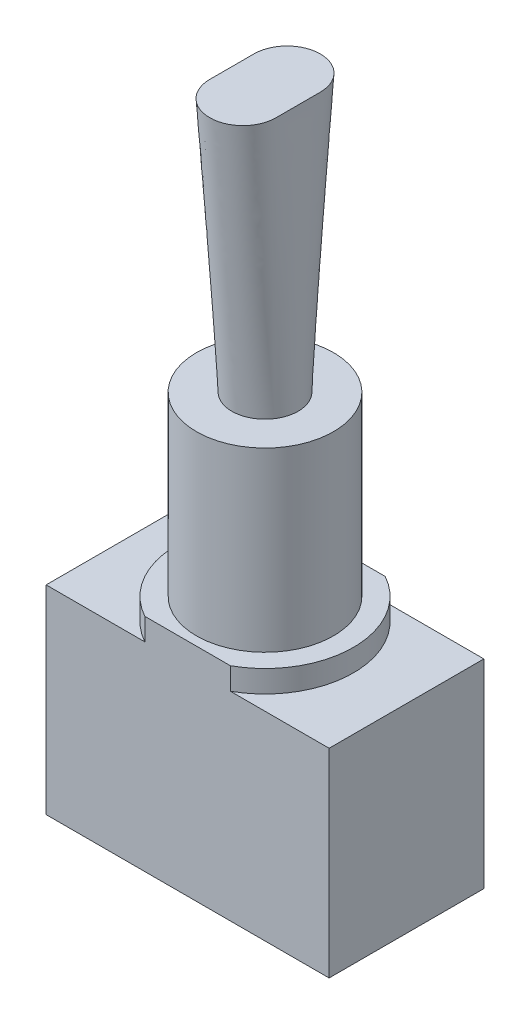
from build123d import *

# Parameters (mm, degrees)
ESQUISSE1_W        = 12.8
ESQUISSE1_H        = 9
BOSS_EXTRU_1_DEPTH = 3.5
BOSS_EXTRU_2_DEPTH = 1
ESQUISSE3_R        = 3.1
BOSS_EXTRU_3_DEPTH = 8


with BuildPart() as part:
    # Esquisse1 → Boss.-Extru.1 (new, symmetric)
    with BuildSketch(Plane.XY):
        with Locations((0, -4.5)):
            Rectangle(ESQUISSE1_W, ESQUISSE1_H)
    extrude(amount=BOSS_EXTRU_1_DEPTH, both=True)

    # Esquisse2 → Boss.-Extru.2 (add)
    with BuildSketch(Plane(origin=(0, 0, 0), x_dir=(1, 0, 0), z_dir=(0, 1, 0))):
        with BuildLine():
            Line((1.936491673, 3.5), (-1.936491673, 3.5))
            ThreePointArc((-1.936491673, 3.5), (-4, 0), (-1.936491673, -3.5))
            Line((-1.936491673, -3.5), (1.936491673, -3.5))
            ThreePointArc((1.936491673, -3.5), (4, 0), (1.936491673, 3.5))
        make_face()
    extrude(amount=BOSS_EXTRU_2_DEPTH)

    # Esquisse3 → Boss.-Extru.3 (add)
    with BuildSketch(Plane(origin=(0, 1, 0), x_dir=(1, 0, 0), z_dir=(0, 1, 0))):
        with Locations(Location((0, 0, 0), (0, 0, 180))):
            Circle(ESQUISSE3_R)
    extrude(amount=BOSS_EXTRU_3_DEPTH)

    # Lissage1: read off the stored shape, not the designer's step
    # Lissage1: loft between two sections, ruled curve by curve
    lissage1_from = [
        Edge.make_bspline([(-1.5, 21, -0.999999999), (-1.5, 21, -1.18566879), (-1.430190912, 21, -1.564549941), (-1.108880999, 21, -2.068285581), (-0.606403504, 21, -2.416848616), (0, 21, -2.541699349), (0.606403504, 21, -2.416848616), (1.108880999, 21, -2.068285581), (1.430190912, 21, -1.564549941), (1.5, 21, -1.18566879), (1.5, 21, -0.811971834), (1.5, 21, -0.473320268), (1.5, 21, 0), (1.5, 21, 0.473320268), (1.5, 21, 0.811971834), (1.5, 21, 1.18566879), (1.430190912, 21, 1.564549941), (1.108880999, 21, 2.068285581), (0.606403504, 21, 2.416848616), (0, 21, 2.541699349), (-0.606403504, 21, 2.416848616), (-1.108880999, 21, 2.068285581), (-1.430190912, 21, 1.564549941), (-1.5, 21, 1.18566879), (-1.5, 21, 0.811971834), (-1.5, 21, 0.473320268), (-1.5, 21, 0), (-1.5, 21, -0.473320268), (-1.5, 21, -0.811971834), (-1.5, 21, -0.999999999)], [0, 0, 0, 0, 0.041490919, 0.082981838, 0.124472757, 0.165963676, 0.207454595, 0.248945514, 0.290436432, 0.331927351, 0.331927351, 0.373945514, 0.415963676, 0.457981838, 0.5, 0.5, 0.541490919, 0.582981838, 0.624472757, 0.665963676, 0.707454595, 0.748945514, 0.790436432, 0.831927351, 0.831927351, 0.873945514, 0.915963676, 0.957981838, 1, 1, 1, 1], 3),
    ]
    lissage1_to = [
        Edge.make_bspline([(-1.248075441, 9, -0.832050294), (-1.175771622, 9, -0.940506024), (-1.006710877, 9, -1.133071374), (-0.699452785, 9, -1.34380864), (-0.358220052, 9, -1.471362722), (0, 9, -1.514343967), (0.358220052, 9, -1.471362722), (0.699452785, 9, -1.34380864), (1.006710877, 9, -1.133071374), (1.175771622, 9, -0.940506024), (1.321298058, 9, -0.72221637), (1.449339658, 9, -0.467018972), (1.525563306, 9, 0), (1.449339658, 9, 0.467018972), (1.321298058, 9, 0.72221637), (1.175771622, 9, 0.940506024), (1.006710877, 9, 1.133071374), (0.699452785, 9, 1.34380864), (0.358220052, 9, 1.471362722), (0, 9, 1.514343967), (-0.358220052, 9, 1.471362722), (-0.699452785, 9, 1.34380864), (-1.006710877, 9, 1.133071374), (-1.175771622, 9, 0.940506024), (-1.321298058, 9, 0.72221637), (-1.449339658, 9, 0.467018972), (-1.525563306, 9, 0), (-1.449339658, 9, -0.467018972), (-1.321298058, 9, -0.72221637), (-1.248075441, 9, -0.832050294)], [0, 0, 0, 0, 0.041490919, 0.082981838, 0.124472757, 0.165963676, 0.207454595, 0.248945514, 0.290436432, 0.331927351, 0.331927351, 0.373945514, 0.415963676, 0.457981838, 0.5, 0.5, 0.541490919, 0.582981838, 0.624472757, 0.665963676, 0.707454595, 0.748945514, 0.790436432, 0.831927351, 0.831927351, 0.873945514, 0.915963676, 0.957981838, 1, 1, 1, 1], 3),
    ]
    lissage1 = Solid(Shell([*[Face.make_surface_from_curves(lissage1_from[k], lissage1_to[k]) for k in range(1)], Face(Wire(lissage1_from)), Face(Wire(lissage1_to))]))
    add(lissage1)


solid = part.part
